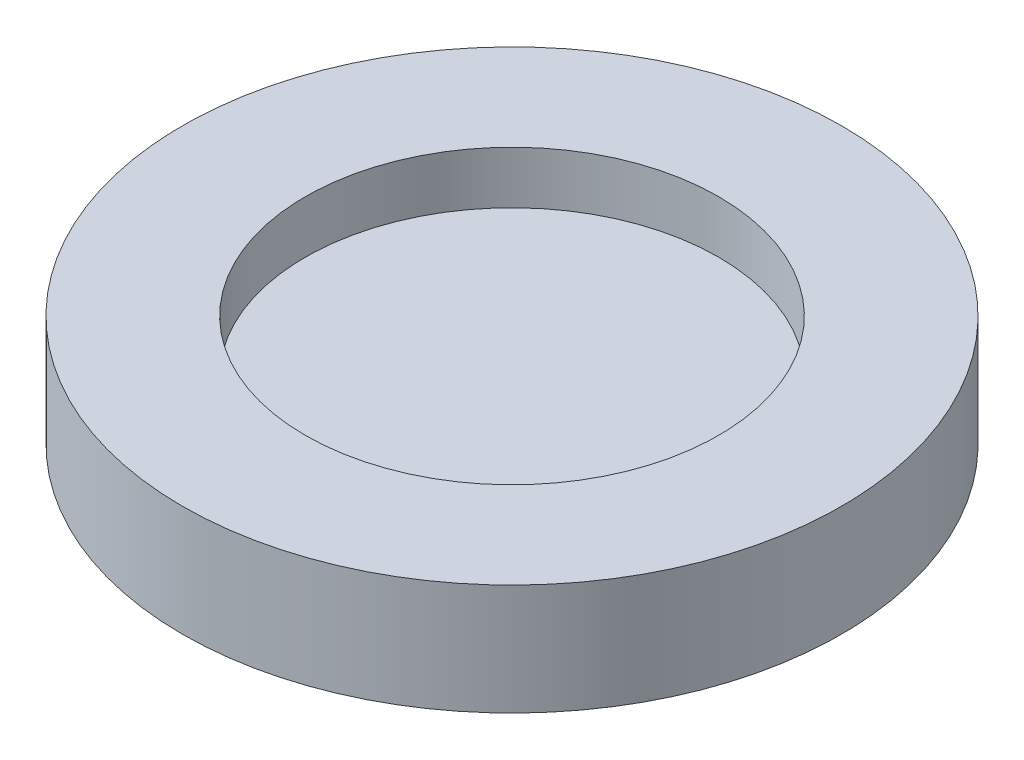
from build123d import *

# Parameters (mm, degrees)
SKETCH1_R                = 11
BOSS_EXTRUDE1_DEPTH      = 3.7
SKETCH2_R                = 6.9
CUT_EXTRUDE1_DEPTH       = 3.7
BOSS_EXTRUDE2_DEPTH      = 0.1
BOSS_EXTRUDE2_DEPTH_BACK = 0.1
SKETCH3_R                = 8.700899362


with BuildPart() as part:
    # Sketch1 → Boss-Extrude1 (new body)
    with BuildSketch(Plane(origin=(0, 0, 0), x_dir=(1, 0, 0), z_dir=(0, 1, 0))):
        Circle(SKETCH1_R)
    extrude(amount=BOSS_EXTRUDE1_DEPTH)

    # Sketch2 → Cut-Extrude1 (cut)
    with BuildSketch(Plane(origin=(0, 3.7, 0), x_dir=(1, 0, 0), z_dir=(0, 1, 0))):
        Circle(SKETCH2_R)
    extrude(amount=-CUT_EXTRUDE1_DEPTH, mode=Mode.SUBTRACT)

    # Sketch3 → Boss-Extrude2 (add, two sides: drawn at the far end of the back side and taken through both)
    with BuildSketch(Plane(origin=(0, 1.85, 0), x_dir=(1, 0, 0), z_dir=(0, 1, 0)).offset(-BOSS_EXTRUDE2_DEPTH_BACK)):
        Circle(SKETCH3_R)
    extrude(amount=BOSS_EXTRUDE2_DEPTH + BOSS_EXTRUDE2_DEPTH_BACK)


solid = part.part
